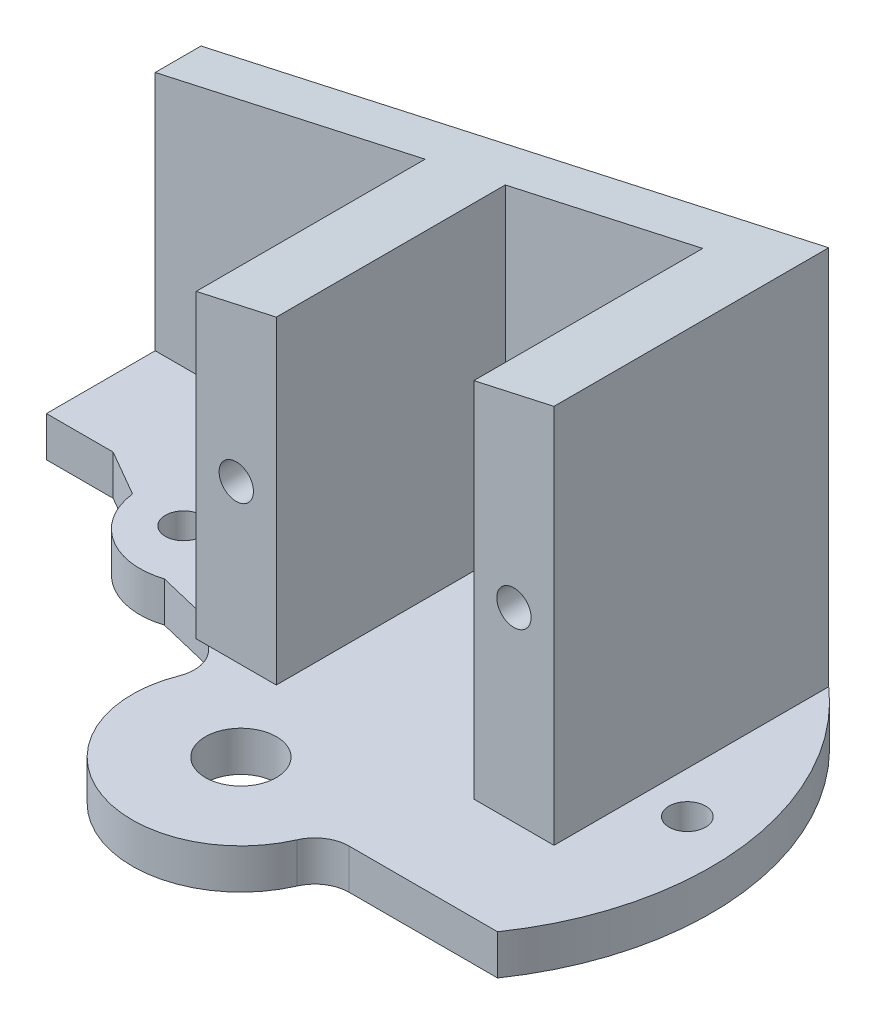
from build123d import *
from build123d.topology import SkipClean

# Parameters (mm, degrees)
CROQUIS1_W              = 70
CROQUIS1_H              = 65
EXTRUIR1_DEPTH          = 3.5
CROQUIS2_R              = 3.1
EXTRUIR2_DEPTH          = 5
EXTRUIR3_DEPTH          = 10
CROQUIS4_OUTSIDE_W      = 91.294
CROQUIS4_OUTSIDE_H      = 86.294
EXTRUIR4_DEPTH          = 10
REDONDEO1_R             = 3
EXTRUIR5_DEPTH          = 13.5
EXTRUIR6_DEPTH          = 3.5
CROQUIS7_R              = 1.6
EXTRUIR7_DEPTH          = 47.982330447
CROQUIS8_R              = 3.1
EXTRUIR8_DEPTH          = 5
CROQUIS9_W              = 0.7
CROQUIS9_H              = 10.5
EXTRUIR9_DEPTH          = 10
EXTRUIR10_DEPTH         = 63.752948337
EXTRUIR10_DEPTH_BACK    = 10
CROQUIS10_W             = 3.0625
CROQUIS10_H             = 5
SALIENTE_EXTRUIR1_DEPTH = 4
SALIENTE_EXTRUIR2_DEPTH = 20
CROQUIS14_R             = 1.5
CORTAR_EXTRUIR2_DEPTH   = 65


with BuildPart() as part:
    # Croquis1 → Extruir1 (new body)
    with BuildSketch(Plane(origin=(0, 0, 0), x_dir=(1, 0, 0), z_dir=(0, 1, 0))):
        Rectangle(CROQUIS1_W, CROQUIS1_H)
    extrude(amount=EXTRUIR1_DEPTH)

    # Croquis2 → Extruir2 (cut)
    with BuildSketch(Plane(origin=(0, 3.5, 0), x_dir=(1, 0, 0), z_dir=(0, 1, 0))):
        with Locations(Location((0, -17.5, 0), (0, 0, 270))):
            Circle(CROQUIS2_R)
    extrude(amount=-EXTRUIR2_DEPTH, mode=Mode.SUBTRACT)

    # Croquis3 → Extruir3 (add)
    with BuildSketch(Plane(origin=(0, 3.5, 0), x_dir=(1, 0, 0), z_dir=(0, 1, 0))):
        with BuildLine():
            Line((-34.4868, 13.5), (20.3496, 13.5))
            Line((20.3496, 13.5), (20.3496, 0))
            Line((20.3496, 0), (17.146428199, 0))
            ThreePointArc((17.146428199, 0), (22.955777517, -8.939493087), (24.418230894, -19.5))
            Line((24.418230894, -19.5), (9.287087811, -19.5))
            ThreePointArc((9.287087811, -19.5), (-3.635492607, -26.276855559), (-7.981176331, -12.347250794))
            Line((-7.981176331, -12.347250794), (-18.680510212, -1.647916913))
            ThreePointArc((-18.680510212, -1.647916913), (-17.932408832, -0.806327142), (-17.146428199, 0))
            Line((-17.146428199, 0), (-34.4868, 0))
            Line((-34.4868, 0), (-34.4868, 13.5))
        make_face()
        with BuildLine():
            Line((-32.9868, 1.5), (-12.961481397, 1.5))
            ThreePointArc((-12.961481397, 1.5), (-14.868021343, 0.048274597), (-16.613165932, -1.593940849))
            Line((-16.613165932, -1.593940849), (-5.999348286, -12.207758495))
            ThreePointArc((-5.999348286, -12.207758495), (-3.061467459, -24.89103626), (7.984359711, -18))
            Line((7.984359711, -18), (22.994564575, -18))
            ThreePointArc((22.994564575, -18), (20.451694563, -6.977253708), (12.961481397, 1.5))
            Line((12.961481397, 1.5), (18.8496, 1.5))
            Line((18.8496, 1.5), (18.8496, 12))
            Line((18.8496, 12), (-32.9868, 12))
            Line((-32.9868, 12), (-32.9868, 1.5))
        make_face(mode=Mode.SUBTRACT)
    extrude(amount=EXTRUIR3_DEPTH)

    # Croquis4 outside → Extruir4 (cut)
    with SkipClean():  # the faces are left unmerged after this step: merging them gives an invalid solid
        with BuildSketch(Plane(origin=(0, 3.5, 0), x_dir=(1, 0, 0), z_dir=(0, 1, 0))):
            Rectangle(CROQUIS4_OUTSIDE_W, CROQUIS4_OUTSIDE_H)
            with BuildLine():
                Line((-34.4868, 0), (-17.146428199, 0))
                ThreePointArc((-17.146428199, 0), (-17.932408832, -0.806327142), (-18.680510212, -1.647916913))
                Line((-18.680510212, -1.647916913), (-7.981176331, -12.347250794))
                ThreePointArc((-7.981176331, -12.347250794), (-3.635492607, -26.276855559), (9.287087811, -19.5))
                Line((9.287087811, -19.5), (24.418230894, -19.5))
                ThreePointArc((24.418230894, -19.5), (22.955777517, -8.939493087), (17.146428199, 0))
                Line((17.146428199, 0), (20.3496, 0))
                Line((20.3496, 0), (20.3496, 13.5))
                Line((20.3496, 13.5), (-34.4868, 13.5))
                Line((-34.4868, 13.5), (-34.4868, 0))
            make_face(mode=Mode.SUBTRACT)
        extrude(amount=-EXTRUIR4_DEPTH, mode=Mode.SUBTRACT)

    # Redondeo1
    redondeo1_edges = [part.edges().sort_by_distance(p)[0] for p in [
        (-7.981176331, 8.5, 12.347250794),
        (9.287087811, 8.5, 19.5),
        (-5.999348286, 8.5, 12.207758495),
        (7.984359711, 8.5, 18),
    ]]
    fillet(redondeo1_edges, radius=REDONDEO1_R)

    # Croquis5 → Extruir5 (add)
    with SkipClean():  # the faces are left unmerged after this step: merging them gives an invalid solid
        with BuildSketch(Plane.XZ):
            with BuildLine():
                Line((-18.680510212, 1.647916913), (-14.437869525, 5.8905576))
                ThreePointArc((-14.437869525, 5.8905576), (-21.723092903, 6.819250451), (-24.449770984, 0))
                Line((-24.449770984, 0), (-17.146428199, 0))
                ThreePointArc((-17.146428199, 0), (-17.932408832, 0.806327142), (-18.680510212, 1.647916913))
            make_face()
            with BuildLine():
                Line((20.3496, 0), (20.3496, -13.5))
                ThreePointArc((20.3496, -13.5), (28.665212431, 2.225567304), (24.418230894, 19.5))
                ThreePointArc((24.418230894, 19.5), (22.955777517, 8.939493087), (17.146428199, 0))
                Line((17.146428199, 0), (20.3496, 0))
            make_face()
        extrude(amount=-EXTRUIR5_DEPTH)

    # Chaflán1
    # the kernel refuses this chamfer: 5, 4.044665138 mm, written as the material it adds along each edge
    with BuildSketch(Plane(origin=(-14.437869525, 3.5, 5.8905576), x_dir=(-0.8768595348589333, 0, 0.4807466652270976), z_dir=(0, 1, 0))) as chafl_n1_piece_1:
        with BuildLine():
            Line((2.949791971, 0), (-1.211824758, 3.780414953))
            Line((-1.211824758, 3.780414953), (-1.307822013, 3.752405544))
            ThreePointArc((-1.307822013, 3.752405544), (-0.651776703, 1.876825504), (-0.095997255, -0.02800941))
            Line((-0.095997255, -0.02800941), (0.02800941, -0.095997255))
            ThreePointArc((0.02800941, -0.095997255), (1.47002525, 0.136406993), (2.931105495, -0.098238565))
            Line((2.931105495, -0.098238565), (2.949791971, 0))
        make_face()
    extrude(amount=10)
    with BuildSketch(Plane(origin=(-24.449770984, 3.5, 0), x_dir=(-0.008036803743584595, 0, 0.9999677043712897), z_dir=(0, 1, 0))) as chafl_n1_piece_2:
        with BuildLine():
            Line((2.423263449, 0), (-0.064845869, -4.38542071))
            Line((-0.064845869, -4.38542071), (-0.164842639, -4.386224391))
            ThreePointArc((-0.164842639, -4.386224391), (-0.082377051, -2.193111839), (-0.09999677, -0.00080368))
            Line((-0.09999677, -0.00080368), (0.026691621, 0.096371974))
            ThreePointArc((0.026691621, 0.096371974), (1.204598314, -0.104316531), (2.411212242, 0.099271186))
            Line((2.411212242, 0.099271186), (2.423263449, 0))
        make_face()
    extrude(amount=10)
    with BuildSketch(Plane(origin=(-24.449770984, 0, 0), x_dir=(-0.9997395779240649, 0, -0.022820524363231526), z_dir=(0, 1, 0))) as chafl_n1_piece_3:
        with BuildLine():
            Line((4.385900112, 0), (-0.035828136, 2.422998574))
            Line((-0.035828136, 2.422998574), (-0.134910293, 2.409480951))
            ThreePointArc((-0.134910293, 2.409480951), (0.08649505, 1.206008973), (-0.096756078, 0.025263837))
            Line((-0.096756078, 0.025263837), (0.002282052, -0.099973958))
            ThreePointArc((0.002282052, -0.099973958), (2.194090072, -0.04994272), (4.388182164, -0.099973958))
            Line((4.388182164, -0.099973958), (4.385900112, 0))
        make_face()
    extrude(amount=3.5)
    with BuildSketch(Plane(origin=(-14.437869525, 0, 5.8905576), x_dir=(0.7254657554746632, 0, 0.6882582637597433), z_dir=(0, 1, 0))) as chafl_n1_piece_4:
        with BuildLine():
            Line((3.96989376, 0), (-0.900434913, -2.809001538))
            Line((-0.900434913, -2.809001538), (-0.98828054, -2.761219262))
            ThreePointArc((-0.98828054, -2.761219262), (-0.318834214, -1.441501248), (-0.099965384, 0.002630967))
            Line((-0.099965384, 0.002630967), (0.002630967, 0.099965384))
            ThreePointArc((0.002630967, 0.099965384), (1.986203869, 0.047760165), (3.972524727, 0.099965384))
            Line((3.972524727, 0.099965384), (3.96989376, 0))
        make_face()
    extrude(amount=3.5)


with BuildPart() as body_2:
    # Croquis6 → Extruir6 (new body)
    with BuildSketch(Plane(origin=(0, 13.5, 0), x_dir=(1, 0, 0), z_dir=(0, 1, 0))):
        with BuildLine():
            Line((-34.4868, 13.5), (-34.4868, 0))
            Line((-34.4868, 0), (-28.661374979, 0))
            Line((-28.661374979, 0), (-24.642400208, -2.323096648))
            ThreePointArc((-24.642400208, -2.323096648), (-21.929637735, -6.692039268), (-16.829963308, -7.355409896))
            Line((-16.829963308, -7.355409896), (-11.752306982, -8.576120143))
            Line((-11.752306982, -8.576120143), (-9.515139435, -10.813287689))
            ThreePointArc((-9.515139435, -10.813287689), (-8.69974084, -12.321679102), (-8.843709432, -14.030302105))
            ThreePointArc((-8.843709432, -14.030302105), (-3.635492607, -26.276855559), (8.70689382, -21.3))
            ThreePointArc((8.70689382, -21.3), (9.813271565, -19.99001992), (11.456439237, -19.5))
            Line((11.456439237, -19.5), (24.418230894, -19.5))
            ThreePointArc((24.418230894, -19.5), (28.665212431, -2.225567304), (20.3496, 13.5))
            Line((20.3496, 13.5), (-34.4868, 13.5))
        make_face()
    extrude(amount=EXTRUIR6_DEPTH)


with BuildPart() as extruir7_tool:
    # Croquis7 → Extruir7 (new, through all)
    with BuildSketch(Plane(origin=(0, 17, 0), x_dir=(1, 0, 0), z_dir=(0, 1, 0))):
        with Locations(Location((-20, -2.5, 0), (0, 0, 270))):
            Circle(CROQUIS7_R)
        with Locations(Location((24, -2.5, 0), (0, 0, 270))):
            Circle(CROQUIS7_R)
    extrude(amount=-EXTRUIR7_DEPTH)


with BuildPart() as part_1:
    add(part.part)

    # Extruir7: cut by extruir7_tool
    add(extruir7_tool.part, mode=Mode.SUBTRACT)

    # Croquis9 → Extruir9 (cut)
    with BuildSketch(Plane(origin=(0, 13.5, 0), x_dir=(1, 0, 0), z_dir=(0, 1, 0))):
        with Locations((19.1996, 6.75)):
            Rectangle(CROQUIS9_W, CROQUIS9_H)
    extrude(amount=-EXTRUIR9_DEPTH, mode=Mode.SUBTRACT)

    # Croquis10 → Extruir10 (cut, two sides: drawn at the far end of the back side and taken through both)
    with BuildSketch(Plane.ZY.offset(-19.5496).offset(-EXTRUIR10_DEPTH_BACK)):
        with Locations((-8.9375, 8.5)):
            Rectangle(CROQUIS10_W, CROQUIS10_H)
    extrude(amount=EXTRUIR10_DEPTH + EXTRUIR10_DEPTH_BACK, mode=Mode.SUBTRACT)


with BuildPart() as body_2_1:
    add(body_2.part)

    # Extruir7: cut by extruir7_tool
    add(extruir7_tool.part, mode=Mode.SUBTRACT)

    # Croquis8 → Extruir8 (cut)
    with BuildSketch(Plane(origin=(0, 17, 0), x_dir=(1, 0, 0), z_dir=(0, 1, 0))):
        with Locations(Location((0, -17.5, 0), (0, 0, 270))):
            Circle(CROQUIS8_R)
    extrude(amount=-EXTRUIR8_DEPTH, mode=Mode.SUBTRACT)

    # Croquis11 → Saliente-Extruir1 (add)
    with BuildSketch(Plane(origin=(0, 0, -13.5), x_dir=(-1, 0, 0), z_dir=(0, 0, -1))):
        Polygon((34.4868, 17), (34.4868, 38.05596306), (-20.3496, 50.212900258), (-20.3496, 17), align=None)
    extrude(amount=-SALIENTE_EXTRUIR1_DEPTH)

    # Croquis13 → Saliente-Extruir2 (add)
    with BuildSketch(Plane.XY.offset(-9.5)):
        Polygon((-10.905631326, 43.283782293), (-3.905631326, 44.835644932), (-3.905631326, 17), (-10.905631326, 17), align=None)
        Polygon((20.3496, 50.212900258), (13.3496, 48.66103762), (13.3496, 17), (20.3496, 17), align=None)
    extrude(amount=SALIENTE_EXTRUIR2_DEPTH)

    # Croquis14 → Cortar-Extruir2 (cut)
    with BuildSketch(Plane.XY.offset(10.5)):
        with Locations((-7.405631326, 30.64159382)):
            Circle(CROQUIS14_R)
        with Locations((16.8496, 33.23257477)):
            Circle(CROQUIS14_R)
    extrude(amount=-CORTAR_EXTRUIR2_DEPTH, mode=Mode.SUBTRACT)


solid = body_2_1.part
